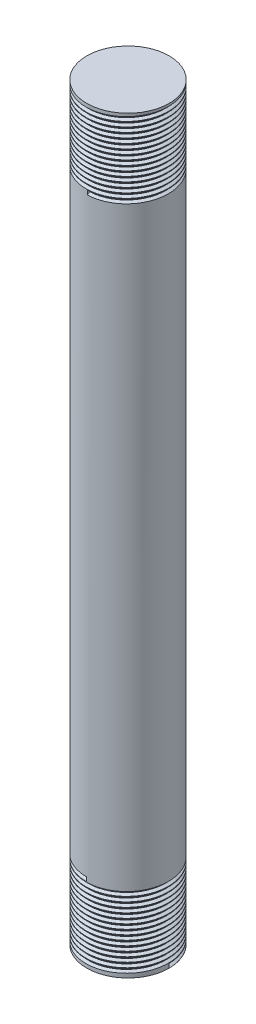
from build123d import *
from build123d.topology import SkipClean

# Parameters (mm, degrees)
SKETCH1_W     = 2.75
SKETCH1_H     = 50
THREAD1_PITCH = 0.3175
THREAD2_PITCH = 0.3175


with BuildPart() as part:
    # Sketch1 → Revolve-Thin1 (revolve)
    with BuildSketch(Plane.XY, mode=Mode.PRIVATE) as revolve_thin1_sk:
        with Locations((1.375, -79.587615611)):
            Rectangle(SKETCH1_W, SKETCH1_H)
    revolve(revolve_thin1_sk.sketch.rotate(Axis((0, -54.587615611, 0), (0, -1, 0)), 180), axis=Axis((0, -54.587615611, 0), (0, -1, 0)))

    # Thread1: arcs per turn and ends read off the stored shape
    # Thread1: the profile of Thread Profile1 profile screwed along a right-hand helix through 15.748031 turns, 6 arcs to a turn; built about Z, then put on its axis
    thread1_z = Axis((0, 0, 0), (0, 0, 1))
    thread1_corners = [(2.7503, 0, -0.000173205), (2.7503, 0, 0.277985704), (2.578148085, 0, 0.17859375), (2.578148085, 0, 0.09921875)]
    with BuildLine(mode=Mode.PRIVATE) as thread1_profile:
        Line(thread1_corners[0], thread1_corners[1])
        Line(thread1_corners[1], thread1_corners[2])
        Line(thread1_corners[2], thread1_corners[3])
        Line(thread1_corners[3], thread1_corners[0])
    thread1_cap = Face(thread1_profile.wire())
    thread1_turn_angles = [0, 30, 60, 90, 120, 150, 180, 210, 240, 270, 300, 330, 360]
    thread1_turn_weights = [1, 0.8660254037844387, 1, 0.8660254037844387, 1, 0.8660254037844387, 1, 0.8660254037844387, 1, 0.8660254037844387, 1, 0.8660254037844387, 1]
    thread1_turn_rails = [Edge.make_bspline([Vector(p[0], p[1], 0).rotate(thread1_z, thread1_turn_angles[k]) / thread1_turn_weights[k] + Vector(0, 0, p[2] + THREAD1_PITCH * thread1_turn_angles[k] / 360) for k in range(13)], [0, 0, 0, 1, 1, 2, 2, 3, 3, 4, 4, 5, 5, 6, 6, 6], 2, thread1_turn_weights) for p in thread1_corners]
    thread1_turn_sides = [Face.make_surface_from_curves(thread1_turn_rails[p[0]], thread1_turn_rails[p[1]]) for p in [(0, 1), (1, 2), (2, 3), (3, 0)]]
    thread1_last_angles = [5400, 5430, 5460, 5490, 5520, 5550, 5580, 5610, 5640, 5654.645669291, 5669.291338583]
    thread1_last_weights = [1, 0.8660254037844387, 1, 0.8660254037844387, 1, 0.8660254037844387, 1, 0.8660254037844387, 1, 0.9675079437748935, 1]
    thread1_last_rails = [Edge.make_bspline([Vector(p[0], p[1], 0).rotate(thread1_z, thread1_last_angles[k]) / thread1_last_weights[k] + Vector(0, 0, p[2] + THREAD1_PITCH * thread1_last_angles[k] / 360) for k in range(11)], [0, 0, 0, 1, 1, 2, 2, 3, 3, 4, 4, 5, 5, 5], 2, thread1_last_weights) for p in thread1_corners]
    thread1_last_sides = [Face.make_surface_from_curves(thread1_last_rails[p[0]], thread1_last_rails[p[1]]) for p in [(0, 1), (1, 2), (2, 3), (3, 0)]]
    thread1 = Plane(origin=(0, -54.587615611, 0), x_dir=(-1, 0, 0), z_dir=(0, -1, 0)) * Solid(Shell([*[p.moved(Location((0, 0, THREAD1_PITCH * i))) for i in range(15) for p in thread1_turn_sides], *thread1_last_sides, thread1_cap, thread1_cap.rotate(thread1_z, 5669.291338583).moved(Location((0, 0, THREAD1_PITCH * 5669.291338583 / 360)))]))
    add(thread1, mode=Mode.SUBTRACT)

    # Thread2: arcs per turn and ends read off the stored shape
    # Thread2: the profile of Thread Profile2 profile screwed along a right-hand helix through 15.748031 turns, 6 arcs to a turn; built about Z, then put on its axis
    with SkipClean():  # the faces are left unmerged after this step: merging them gives an invalid solid
        thread2_z = Axis((0, 0, 0), (0, 0, 1))
        thread2_corners = [(2.7503, 0, -0.000173205), (2.7503, 0, 0.277985704), (2.578148085, 0, 0.178593749), (2.578148085, 0, 0.099218749)]
        with BuildLine(mode=Mode.PRIVATE) as thread2_profile:
            Line(thread2_corners[0], thread2_corners[1])
            Line(thread2_corners[1], thread2_corners[2])
            Line(thread2_corners[2], thread2_corners[3])
            Line(thread2_corners[3], thread2_corners[0])
        thread2_cap = Face(thread2_profile.wire())
        thread2_turn_angles = [0, 30, 60, 90, 120, 150, 180, 210, 240, 270, 300, 330, 360]
        thread2_turn_weights = [1, 0.8660254037844387, 1, 0.8660254037844387, 1, 0.8660254037844387, 1, 0.8660254037844387, 1, 0.8660254037844387, 1, 0.8660254037844387, 1]
        thread2_turn_rails = [Edge.make_bspline([Vector(p[0], p[1], 0).rotate(thread2_z, thread2_turn_angles[k]) / thread2_turn_weights[k] + Vector(0, 0, p[2] + THREAD2_PITCH * thread2_turn_angles[k] / 360) for k in range(13)], [0, 0, 0, 1, 1, 2, 2, 3, 3, 4, 4, 5, 5, 6, 6, 6], 2, thread2_turn_weights) for p in thread2_corners]
        thread2_turn_sides = [Face.make_surface_from_curves(thread2_turn_rails[p[0]], thread2_turn_rails[p[1]]) for p in [(0, 1), (1, 2), (2, 3), (3, 0)]]
        thread2_last_angles = [5400, 5430, 5460, 5490, 5520, 5550, 5580, 5610, 5640, 5654.645669291, 5669.291338583]
        thread2_last_weights = [1, 0.8660254037844387, 1, 0.8660254037844387, 1, 0.8660254037844387, 1, 0.8660254037844387, 1, 0.9675079437748935, 1]
        thread2_last_rails = [Edge.make_bspline([Vector(p[0], p[1], 0).rotate(thread2_z, thread2_last_angles[k]) / thread2_last_weights[k] + Vector(0, 0, p[2] + THREAD2_PITCH * thread2_last_angles[k] / 360) for k in range(11)], [0, 0, 0, 1, 1, 2, 2, 3, 3, 4, 4, 5, 5, 5], 2, thread2_last_weights) for p in thread2_corners]
        thread2_last_sides = [Face.make_surface_from_curves(thread2_last_rails[p[0]], thread2_last_rails[p[1]]) for p in [(0, 1), (1, 2), (2, 3), (3, 0)]]
        thread2 = Plane(origin=(0, -104.587615611, 0), x_dir=(1, 0, 0), z_dir=(0, 1, 0)) * Solid(Shell([*[p.moved(Location((0, 0, THREAD2_PITCH * i))) for i in range(15) for p in thread2_turn_sides], *thread2_last_sides, thread2_cap, thread2_cap.rotate(thread2_z, 5669.291338583).moved(Location((0, 0, THREAD2_PITCH * 5669.291338583 / 360)))]))
        add(thread2, mode=Mode.SUBTRACT)


solid = part.part
